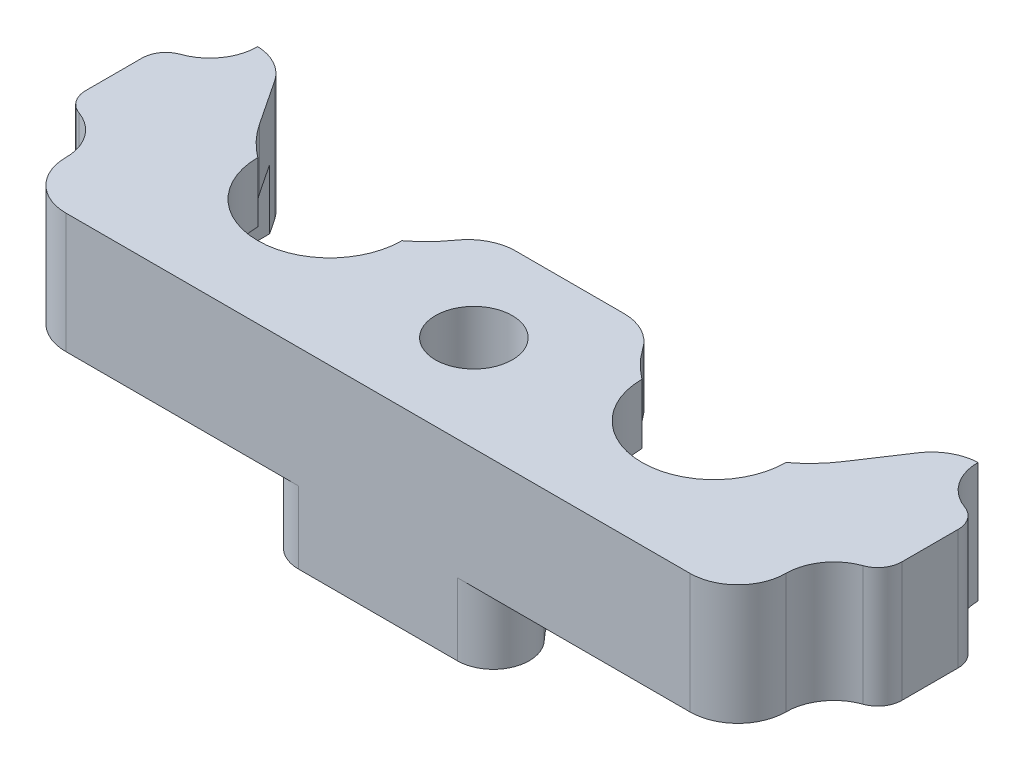
from build123d import *
from build123d.topology import SkipClean

# Parameters (mm, degrees)
SKETCH_1_R          = 1.6
EXTRUDE_1_DEPTH     = 5
CUT_EXTRUDE_1_DEPTH = 2.5
CUT_EXTRUDE_3_DEPTH = 17.347782724
CUT_EXTRUDE_4_DEPTH = 17.911534525
SKETCH_8_W          = 6.83484861
SKETCH_8_H          = 2
CUT_EXTRUDE_5_DEPTH = 17.911534525
EXTRUDE_START       = 3
SKETCH_14_R         = 1.6
EXTRUDE_7_DEPTH     = 3
FILLET_2_R          = 2
SKETCH_15_W         = 2
SKETCH_15_H         = 4
EXTRUDE_8_DEPTH     = 5
FILLET_3_R          = 2
FILLET_4_R          = 1


# Some blends are built 0.0001 mm under size
with BuildPart() as part:
    # 草图1 → 凸台-拉伸1 (new body)
    with BuildSketch(Plane(origin=(0, 0, 0), x_dir=(1, 0, 0), z_dir=(0, 1, 0))):
        Polygon((-15, -4), (15, -4), (15, 4), (15, 6), (-15, 6), (-15, 4), align=None)
        with Locations(Location((0, 0, 0), (0, 0, 270))):
            Circle(SKETCH_1_R, mode=Mode.SUBTRACT)
    extrude(amount=EXTRUDE_1_DEPTH)

    # 草图4 → 切除-拉伸1 (cut)
    with BuildSketch(Plane.XZ):
        with BuildLine():
            Line((-13, -6), (-13, -2))
            ThreePointArc((-13, -2), (-8, 3), (-3, -2))
            Line((-3, -2), (-3, -6))
            ThreePointArc((-3, -6), (-8, -11), (-13, -6))
        make_face()
        with BuildLine():
            Line((13, -6), (13, -2))
            ThreePointArc((13, -2), (8, 3), (3, -2))
            Line((3, -2), (3, -6))
            ThreePointArc((3, -6), (8, -11), (13, -6))
        make_face()
    extrude(amount=-CUT_EXTRUDE_1_DEPTH, mode=Mode.SUBTRACT)

    # 草图6 → 切除-拉伸3 (cut, through all)
    with BuildSketch(Plane.XZ.offset(-2.5)):
        with BuildLine():
            Line((-11, -6), (-11, -2))
            ThreePointArc((-11, -2), (-8, 1), (-5, -2))
            Line((-5, -2), (-5, -6))
            ThreePointArc((-5, -6), (-8, -9), (-11, -6))
        make_face()
        with BuildLine():
            Line((11, -6), (11, -2))
            ThreePointArc((11, -2), (8, 1), (5, -2))
            Line((5, -2), (5, -6))
            ThreePointArc((5, -6), (8, -9), (11, -6))
        make_face()
    extrude(amount=-CUT_EXTRUDE_3_DEPTH, mode=Mode.SUBTRACT)

    # 草图7 → 切除-拉伸4 (cut, through all)
    with BuildSketch(Plane.XZ):
        with BuildLine():
            Line((-12.166666667, -3.236146008), (-14, -6))
            Line((-14, -6), (-13, -6))
            ThreePointArc((-13, -6), (-3.212864461, -7.443375673), (-12.166666667, -3.236146008))
        make_face()
        with BuildLine():
            Line((14, -6), (13, -6))
            ThreePointArc((13, -6), (3.212864461, -7.443375673), (12.166666667, -3.236146008))
            Line((12.166666667, -3.236146008), (14, -6))
        make_face()
    extrude(amount=-CUT_EXTRUDE_4_DEPTH, mode=Mode.SUBTRACT)

    # 草图8 → 切除-拉伸5 (cut, through all)
    with BuildSketch(Plane.XZ):
        with Locations((0, -5)):
            Rectangle(SKETCH_8_W, SKETCH_8_H)
    extrude(amount=-CUT_EXTRUDE_5_DEPTH, mode=Mode.SUBTRACT)

    # 草图14 → 凸台-拉伸7 (add)
    with SkipClean():  # the faces are left unmerged after this step: merging them gives an invalid solid
        with BuildSketch(Plane.XZ.offset(EXTRUDE_START)):
            with BuildLine():
                Line((-3, -2), (-3, -4))
                Line((-3, -4), (3, -4))
                Line((3, -4), (3, -2))
                ThreePointArc((3, -2), (3.361031331, -0.134532313), (4.391987877, 1.461538462))
                ThreePointArc((4.391987877, 1.461538462), (4.689383557, 3.088348405), (3.30958424, 4))
                Line((3.30958424, 4), (-3.30958424, 4))
                ThreePointArc((-3.30958424, 4), (-4.689383557, 3.088348405), (-4.391987877, 1.461538462))
                ThreePointArc((-4.391987877, 1.461538462), (-3.361031331, -0.134532313), (-3, -2))
            make_face()
            Circle(SKETCH_14_R, mode=Mode.SUBTRACT)
        extrude(amount=-EXTRUDE_7_DEPTH)

    # 圆角2
    # the kernel refuses this fillet: 2 mm, written as the material it takes off along each edge
    with BuildSketch(Plane(origin=(-3, -8, -4), x_dir=(0, 0, 1), z_dir=(0, 1, 0)), Plane(origin=(3, -8, -4), x_dir=(-1, 0, 0), z_dir=(0, 1, 0))) as fillet_2_piece_1:
        with BuildLine():
            CenterArc((FILLET_2_R, FILLET_2_R), FILLET_2_R, 180, 90)
            Line((0, FILLET_2_R), (0, 0))
            Line((0, 0), (FILLET_2_R, 0))
        make_face()
    extrude(amount=8, mode=Mode.SUBTRACT)
    with BuildSketch(Plane(origin=(-15, -5, 4), x_dir=(1, 0, 0), z_dir=(0, 1, 0))) as fillet_2_piece_2:
        with BuildLine():
            CenterArc((FILLET_2_R, FILLET_2_R), FILLET_2_R, 180, 90)
            Line((0, FILLET_2_R), (0, 0))
            Line((0, 0), (FILLET_2_R, 0))
        make_face()
    extrude(amount=15, mode=Mode.SUBTRACT)
    with BuildSketch(Plane(origin=(15, -5, 4), x_dir=(-1, 0, 0), z_dir=(0, 1, 0))) as fillet_2_piece_3:
        with BuildLine():
            CenterArc((FILLET_2_R, -FILLET_2_R), FILLET_2_R, 90, 90)
            Line((0, -FILLET_2_R), (0, 0))
            Line((0, 0), (FILLET_2_R, 0))
        make_face()
    extrude(amount=15, mode=Mode.SUBTRACT)
    with BuildSketch(Plane(origin=(14, -2.679237314, -6), x_dir=(1, 0, 0), z_dir=(0, 1, 0))) as fillet_2_piece_4:
        with BuildLine():
            CenterArc((1.074265007, -1.998620702), FILLET_2_R, 92.128024951, 54.314665287)
            Line((-0.59240166, -0.893079105), (0, 0))
            Line((0, 0), (1, 0))
        make_face()
    extrude(amount=10.358474629, mode=Mode.SUBTRACT)
    with BuildSketch(Plane(origin=(-14, -2.679237314, -6), x_dir=(-1, 0, 0), z_dir=(0, 1, 0))) as fillet_2_piece_5:
        with BuildLine():
            CenterArc((1.074265007, 1.998620702), FILLET_2_R, 213.557309762, 54.314665287)
            Line((-0.59240166, 0.893079105), (0, 0))
            Line((0, 0), (1, 0))
        make_face()
    extrude(amount=10.358474629, mode=Mode.SUBTRACT)
    with BuildSketch(Plane(origin=(3, 2.5, -4), x_dir=(-1, 0, 0), z_dir=(0, -1, 0))) as fillet_2_piece_6:
        with BuildLine():
            CenterArc((FILLET_2_R, -FILLET_2_R), FILLET_2_R, 90, 90)
            Line((0, -FILLET_2_R), (0, 0))
            Line((0, 0), (FILLET_2_R, 0))
        make_face()
    extrude(amount=2.5, mode=Mode.SUBTRACT)
    with BuildSketch(Plane(origin=(-3, 2.5, -4), x_dir=(1, 0, 0), z_dir=(0, -1, 0))) as fillet_2_piece_7:
        with BuildLine():
            CenterArc((FILLET_2_R, FILLET_2_R), FILLET_2_R, 180, 90)
            Line((0, FILLET_2_R), (0, 0))
            Line((0, 0), (FILLET_2_R, 0))
        make_face()
    extrude(amount=2.5, mode=Mode.SUBTRACT)

    # 草图15 → 凸台-拉伸8 (add)
    with BuildSketch(Plane.XZ):
        with Locations((16, -2)):
            Rectangle(SKETCH_15_W, SKETCH_15_H)
        with Locations((-16, -2)):
            Rectangle(SKETCH_15_W, SKETCH_15_H)
    extrude(amount=-EXTRUDE_8_DEPTH)

    # 圆角3
    fillet_3_edges = [part.edges().sort_by_distance(p)[0] for p in [
        (3.417424305, 3.75, -4),
        (-3.417424305, 3.75, -4),
        (-15, 2.5, 0),
        (15, 2.5, 0),
        (-15, 2.5, -4),
        (15, 2.5, -4),
    ]]
    fillet(fillet_3_edges, radius=FILLET_3_R - 0.0001)  # a hair under: the kernel refuses the full size

    # 圆角4
    fillet_4_edges = [part.edges().sort_by_distance(p)[0] for p in [
        (17, 2.5, 0),
        (17, 2.5, -4),
        (-17, 2.5, -4),
        (-17, 2.5, 0),
    ]]
    fillet(fillet_4_edges, radius=FILLET_4_R)


solid = part.part
